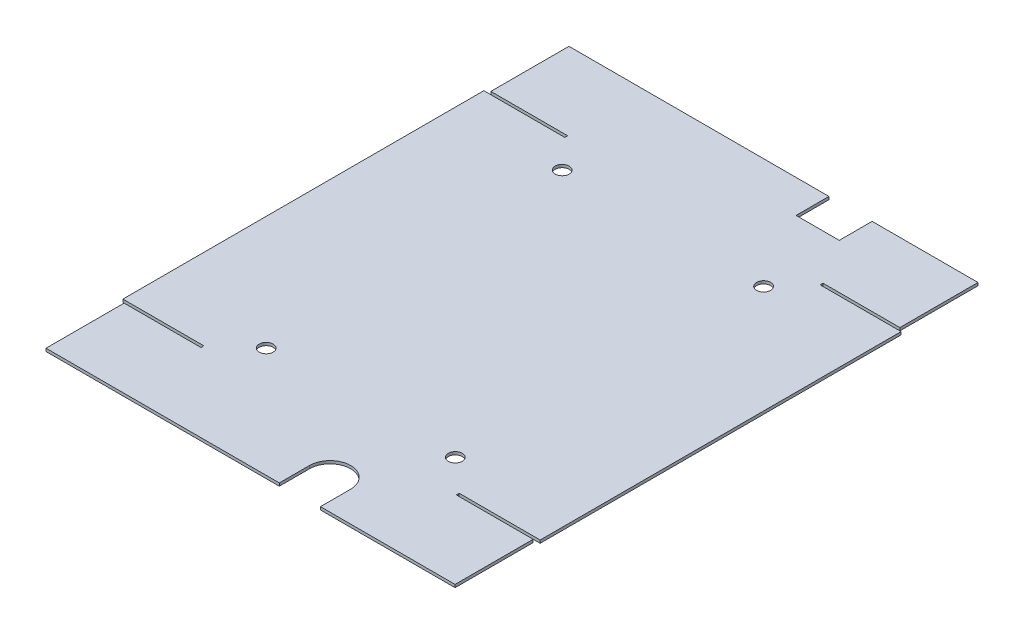
from build123d import *

# Parameters (mm, degrees)
SKETCH1_W                 = 62.1
SKETCH1_H                 = 0.7
BASE_FLANGE1_DEPTH        = 87.8
EDGE_FLANGE1_DEPTH        = 87.8
EDGE_FLANGE2_DEPTH        = 87.8
EDGE_FLANGE3_DEPTH        = 62.1
CUT_EXTRUDE2_DEPTH        = 0.7
SKETCH14_R                = 1.7
CUT_EXTRUDE3_DEPTH        = 0.7
EDGE_FLANGE4_DEPTH        = 19
EDGE_FLANGE5_DEPTH        = 19
EDGE_FLANGE6_DEPTH        = 62.1
EDGE_FLANGE7_DEPTH        = 19
EDGE_FLANGE8_DEPTH        = 19
SKETCH32_W                = 10.5
SKETCH32_H                = 8
CUT_EXTRUDE5_DEPTH        = 0.7
FLAT_PATTERN1_START       = -20.7
FLAT_PATTERN1_OUTLINE_R   = 1.7
FLAT_PATTERN1_DEPTH       = 20
FLAT_PATTERN1_START_2     = -0.7
FLAT_PATTERN1_2_OUTLINE_R = 1.7
FLAT_PATTERN1_2_DEPTH     = 0.7


with BuildPart() as part:
    # Base-Flange1: sheet metal written as solids
    # Sketch1 → Base-Flange1 (new body)
    with BuildSketch(Plane.XY):
        with Locations((31.05, -0.35)):
            Rectangle(SKETCH1_W, SKETCH1_H)
    extrude(amount=BASE_FLANGE1_DEPTH)

    # Edge-Flange1: sheet metal written as solids
    # Edge-Flange1 section (on a plane across the edge) → Edge-Flange1 (add)
    with BuildSketch(Plane(origin=(63.1, -0.7, 0), x_dir=(-1, 0, 0), z_dir=(0, 0, 1))):
        with BuildLine():
            Line((-0.7, 1), (-0.7, 20))
            Line((-0.7, 20), (0, 20))
            Line((0, 20), (0, 1))
            ThreePointArc((0, 1), (0.292893219, 0.292893219), (1, 0))
            Line((1, 0), (1, -0.7))
            ThreePointArc((1, -0.7), (-0.202081528, -0.202081528), (-0.7, 1))
        make_face()
    extrude(amount=EDGE_FLANGE1_DEPTH)

    # Edge-Flange2: sheet metal written as solids
    # Edge-Flange2 section (on a plane across the edge) → Edge-Flange2 (add)
    with BuildSketch(Plane(origin=(-1, -0.7, 87.8), x_dir=(1, 0, 0), z_dir=(0, 0, -1))):
        with BuildLine():
            Line((-0.7, 1), (-0.7, 20))
            Line((-0.7, 20), (0, 20))
            Line((0, 20), (0, 1))
            ThreePointArc((0, 1), (0.292893219, 0.292893219), (1, 0))
            Line((1, 0), (1, -0.7))
            ThreePointArc((1, -0.7), (-0.202081528, -0.202081528), (-0.7, 1))
        make_face()
    extrude(amount=EDGE_FLANGE2_DEPTH)

    # Edge-Flange3: sheet metal written as solids
    # Edge-Flange3 section (on a plane across the edge) → Edge-Flange3 (add)
    with BuildSketch(Plane(origin=(62.1, -0.7, 88.8), x_dir=(0, 0, -1), z_dir=(-1, 0, 0))):
        with BuildLine():
            Line((-0.7, 1), (-0.7, 20))
            Line((-0.7, 20), (0, 20))
            Line((0, 20), (0, 1))
            ThreePointArc((0, 1), (0.292893219, 0.292893219), (1, 0))
            Line((1, 0), (1, -0.7))
            ThreePointArc((1, -0.7), (-0.202081528, -0.202081528), (-0.7, 1))
        make_face()
    extrude(amount=EDGE_FLANGE3_DEPTH)

    # Sketch13 → Cut-Extrude2 (cut)
    with BuildSketch(Plane.XY.offset(89.5)):
        with BuildLine():
            Line((38.05, -13.35), (38.05, -20.7))
            Line((38.05, -20.7), (48.05, -20.7))
            Line((48.05, -20.7), (48.05, -13.35))
            ThreePointArc((48.05, -13.35), (43.05, -8.35), (38.05, -13.35))
        make_face()
    extrude(amount=-CUT_EXTRUDE2_DEPTH, mode=Mode.SUBTRACT)

    # Sketch14 → Cut-Extrude3 (cut)
    with BuildSketch(Plane(origin=(0, 0, 0), x_dir=(1, 0, 0), z_dir=(0, 1, 0))):
        with Locations(Location((6.55, -7.2, 0), (0, 0, 270))):
            Circle(SKETCH14_R)
        with Locations(Location((55.55, -7.2, 0), (0, 0, 270))):
            Circle(SKETCH14_R)
        with Locations(Location((8.05, -80.7, 0), (0, 0, 270))):
            Circle(SKETCH14_R)
        with Locations(Location((54.05, -80.7, 0), (0, 0, 270))):
            Circle(SKETCH14_R)
    extrude(amount=-CUT_EXTRUDE3_DEPTH, mode=Mode.SUBTRACT)

    # Edge-Flange4: sheet metal written as solids
    # Edge-Flange4 section (on a plane across the edge) → Edge-Flange4 (add)
    with BuildSketch(Plane(origin=(64.1, -1.7, 88.8), x_dir=(-1, 0, 0), z_dir=(0, -1, 0))):
        with BuildLine():
            Line((-0.7, 2), (-0.7, 20))
            Line((-0.7, 20), (0, 20))
            Line((0, 20), (0, 2))
            ThreePointArc((0, 2), (0.585786438, 0.585786438), (2, 0))
            Line((2, 0), (2, -0.7))
            ThreePointArc((2, -0.7), (0.090811691, 0.090811691), (-0.7, 2))
        make_face()
    extrude(amount=EDGE_FLANGE4_DEPTH)

    # Edge-Flange5: sheet metal written as solids
    # Edge-Flange5 section (on a plane across the edge) → Edge-Flange5 (add)
    with BuildSketch(Plane(origin=(-2, -20.7, 88.8), x_dir=(1, 0, 0), z_dir=(0, 1, 0))):
        with BuildLine():
            Line((-0.7, 2), (-0.7, 20))
            Line((-0.7, 20), (0, 20))
            Line((0, 20), (0, 2))
            ThreePointArc((0, 2), (0.585786438, 0.585786438), (2, 0))
            Line((2, 0), (2, -0.7))
            ThreePointArc((2, -0.7), (0.090811691, 0.090811691), (-0.7, 2))
        make_face()
    extrude(amount=EDGE_FLANGE5_DEPTH)

    # Edge-Flange6: sheet metal written as solids
    # Edge-Flange6 section (on a plane across the edge) → Edge-Flange6 (add)
    with BuildSketch(Plane(origin=(0, -0.7, -1), x_dir=(0, 0, 1), z_dir=(1, 0, 0))):
        with BuildLine():
            Line((-0.7, 1), (-0.7, 20))
            Line((-0.7, 20), (0, 20))
            Line((0, 20), (0, 1))
            ThreePointArc((0, 1), (0.292893219, 0.292893219), (1, 0))
            Line((1, 0), (1, -0.7))
            ThreePointArc((1, -0.7), (-0.202081528, -0.202081528), (-0.7, 1))
        make_face()
    extrude(amount=EDGE_FLANGE6_DEPTH)

    # Edge-Flange7: sheet metal written as solids
    # Edge-Flange7 section (on a plane across the edge) → Edge-Flange7 (add)
    with BuildSketch(Plane(origin=(64.1, -20.7, -1), x_dir=(-1, 0, 0), z_dir=(0, 1, 0))):
        with BuildLine():
            Line((-0.7, 2), (-0.7, 20))
            Line((-0.7, 20), (0, 20))
            Line((0, 20), (0, 2))
            ThreePointArc((0, 2), (0.585786438, 0.585786438), (2, 0))
            Line((2, 0), (2, -0.7))
            ThreePointArc((2, -0.7), (0.090811691, 0.090811691), (-0.7, 2))
        make_face()
    extrude(amount=EDGE_FLANGE7_DEPTH)

    # Edge-Flange8: sheet metal written as solids
    # Edge-Flange8 section (on a plane across the edge) → Edge-Flange8 (add)
    with BuildSketch(Plane(origin=(-2, -1.7, -1), x_dir=(1, 0, 0), z_dir=(0, -1, 0))):
        with BuildLine():
            Line((-0.7, 2), (-0.7, 20))
            Line((-0.7, 20), (0, 20))
            Line((0, 20), (0, 2))
            ThreePointArc((0, 2), (0.585786438, 0.585786438), (2, 0))
            Line((2, 0), (2, -0.7))
            ThreePointArc((2, -0.7), (0.090811691, 0.090811691), (-0.7, 2))
        make_face()
    extrude(amount=EDGE_FLANGE8_DEPTH)

    # Sketch32 → Cut-Extrude5 (cut)
    with BuildSketch(Plane(origin=(0, 0, -1.7), x_dir=(-1, 0, 0), z_dir=(0, 0, -1))):
        with Locations((-49.8006007, -16.7)):
            Rectangle(SKETCH32_W, SKETCH32_H)
    extrude(amount=-CUT_EXTRUDE5_DEPTH, mode=Mode.SUBTRACT)

    # Flat-Pattern1: read off the stored shape, not the designer's step
    # Flat-Pattern1 outline → Flat-Pattern1 (cut)
    with BuildSketch(Plane(origin=(0, 0, 0), x_dir=(1, 0, 0), z_dir=(0, 1, 0)).offset(FLAT_PATTERN1_START)):
        with BuildLine():
            Line((-1.7, 0), (-1.7, -87.8))
            Line((-1.7, -87.8), (0, -87.8))
            Line((0, -87.8), (0, -88.5))
            Line((0, -88.5), (-1.053565375, -88.5))
            ThreePointArc((-1.053565375, -88.5), (-1.747445385, -87.772848716), (-2, -86.8))
            Line((-2, -86.8), (-2, -68.8))
            Line((-2, -68.8), (-2.7, -68.8))
            Line((-2.7, -68.8), (-2.7, -86.8))
            ThreePointArc((-2.7, -86.8), (-2.54495263, -87.701784958), (-2.097617696, -88.5))
            Line((-2.097617696, -88.5), (-18.7, -88.5))
            Line((-18.7, -88.5), (-18.7, -107.5))
            Line((-18.7, -107.5), (38.05, -107.5))
            Line((38.05, -107.5), (38.05, -100.15))
            ThreePointArc((38.05, -100.15), (43.05, -95.15), (48.05, -100.15))
            Line((48.05, -100.15), (48.05, -107.5))
            Line((48.05, -107.5), (80.8, -107.5))
            Line((80.8, -107.5), (80.8, -88.5))
            Line((80.8, -88.5), (64.197617696, -88.5))
            ThreePointArc((64.197617696, -88.5), (64.64495263, -87.701784958), (64.8, -86.8))
            Line((64.8, -86.8), (64.8, -68.8))
            Line((64.8, -68.8), (64.1, -68.8))
            Line((64.1, -68.8), (64.1, -86.8))
            ThreePointArc((64.1, -86.8), (63.847445385, -87.772848716), (63.153565375, -88.5))
            Line((63.153565375, -88.5), (62.1, -88.5))
            Line((62.1, -88.5), (62.1, -87.8))
            Line((62.1, -87.8), (63.8, -87.8))
            Line((63.8, -87.8), (63.8, 0))
            Line((63.8, 0), (62.1, 0))
            Line((62.1, 0), (62.1, 0.7))
            Line((62.1, 0.7), (63.153565375, 0.7))
            ThreePointArc((63.153565375, 0.7), (63.847445385, -0.027151284), (64.1, -1))
            Line((64.1, -1), (64.1, -19))
            Line((64.1, -19), (64.8, -19))
            Line((64.8, -19), (64.8, -1))
            ThreePointArc((64.8, -1), (64.009188309, 0.909188309), (62.1, 1.7))
            Line((62.1, 1.7), (0, 1.7))
            ThreePointArc((0, 1.7), (-1.909188309, 0.909188309), (-2.7, -1))
            Line((-2.7, -1), (-2.7, -19))
            Line((-2.7, -19), (-2, -19))
            Line((-2, -19), (-2, -1))
            ThreePointArc((-2, -1), (-1.747445385, -0.027151284), (-1.053565375, 0.7))
            Line((-1.053565375, 0.7), (0, 0.7))
            Line((0, 0.7), (0, 0))
            Line((0, 0), (-1.7, 0))
        make_face()
        with Locations((55.55, -7.2)):
            Circle(FLAT_PATTERN1_OUTLINE_R, mode=Mode.SUBTRACT)
        with Locations((8.05, -80.7)):
            Circle(FLAT_PATTERN1_OUTLINE_R, mode=Mode.SUBTRACT)
        with Locations((54.05, -80.7)):
            Circle(FLAT_PATTERN1_OUTLINE_R, mode=Mode.SUBTRACT)
        with Locations((6.55, -7.2)):
            Circle(FLAT_PATTERN1_OUTLINE_R, mode=Mode.SUBTRACT)
    extrude(amount=FLAT_PATTERN1_DEPTH, mode=Mode.SUBTRACT)

    # Flat-Pattern1 2 outline → Flat-Pattern1 2 (add)
    with BuildSketch(Plane(origin=(0, 0, 0), x_dir=(1, 0, 0), z_dir=(0, 1, 0)).offset(FLAT_PATTERN1_START_2)):
        with BuildLine():
            Line((0, -87.8), (0, -88.5))
            Line((0, -88.5), (-18.7, -88.5))
            Line((-18.7, -88.5), (-18.7, -107.5))
            Line((-18.7, -107.5), (38.05, -107.5))
            Line((38.05, -107.5), (38.05, -100.15))
            ThreePointArc((38.05, -100.15), (43.05, -95.15), (48.05, -100.15))
            Line((48.05, -100.15), (48.05, -107.5))
            Line((48.05, -107.5), (80.8, -107.5))
            Line((80.8, -107.5), (80.8, -88.5))
            Line((80.8, -88.5), (62.1, -88.5))
            Line((62.1, -88.5), (62.1, -87.8))
            Line((62.1, -87.8), (81.8, -87.8))
            Line((81.8, -87.8), (81.8, 0))
            Line((81.8, 0), (62.1, 0))
            Line((62.1, 0), (62.1, 0.7))
            Line((62.1, 0.7), (80.8, 0.7))
            Line((80.8, 0.7), (80.8, 19.7))
            Line((80.8, 19.7), (55.0506007, 19.7))
            Line((55.0506007, 19.7), (55.0506007, 11.7))
            Line((55.0506007, 11.7), (44.5506007, 11.7))
            Line((44.5506007, 11.7), (44.5506007, 19.7))
            Line((44.5506007, 19.7), (-18.7, 19.7))
            Line((-18.7, 19.7), (-18.7, 0.7))
            Line((-18.7, 0.7), (0, 0.7))
            Line((0, 0.7), (0, 0))
            Line((0, 0), (-19.7, 0))
            Line((-19.7, 0), (-19.7, -87.8))
            Line((-19.7, -87.8), (0, -87.8))
        make_face()
        with Locations((55.55, -7.2)):
            Circle(FLAT_PATTERN1_2_OUTLINE_R, mode=Mode.SUBTRACT)
        with Locations((8.05, -80.7)):
            Circle(FLAT_PATTERN1_2_OUTLINE_R, mode=Mode.SUBTRACT)
        with Locations((54.05, -80.7)):
            Circle(FLAT_PATTERN1_2_OUTLINE_R, mode=Mode.SUBTRACT)
        with Locations((6.55, -7.2)):
            Circle(FLAT_PATTERN1_2_OUTLINE_R, mode=Mode.SUBTRACT)
    extrude(amount=FLAT_PATTERN1_2_DEPTH)


solid = part.part
